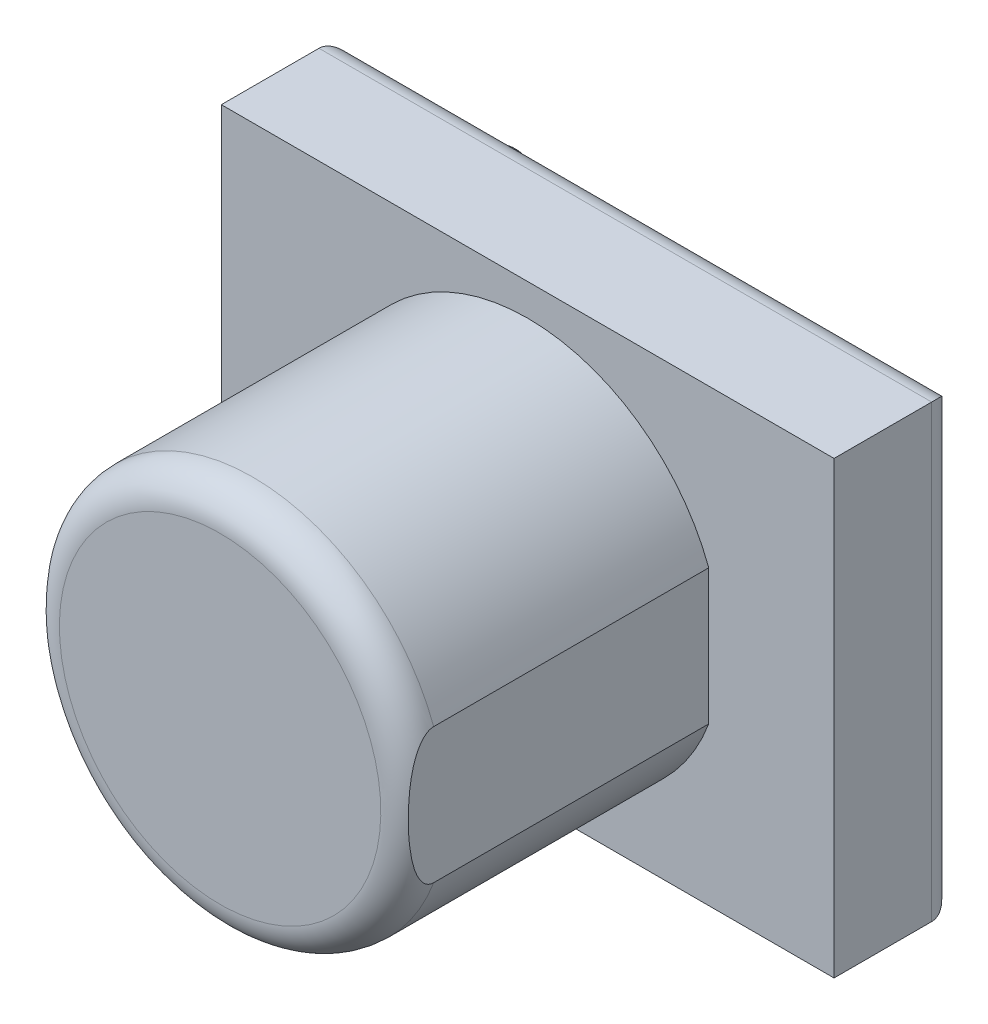
from build123d import *

# Parameters (mm, degrees)
SKETCH1_W               = 11.303
SKETCH1_H               = 4.219764922
BOSS_EXTRUDE1_DEPTH     = 9.6012
SKETCH2_W               = 19.1262
SKETCH2_H               = 14.0462
BOSS_EXTRUDE2_DEPTH     = 3.81
SKETCH3_W               = 14.8082
SKETCH3_H               = 8.763
BOSS_EXTRUDE3_DEPTH     = 2.921
CUT_EXTRUDE1_DEPTH      = 18.711601402
CUT_EXTRUDE1_DEPTH_BACK = 18.711601402
FILLET1_R               = 0.762
FILLET2_R               = 0.762
FILLET3_R               = 0.762
FILLET4_R               = 1.016


with BuildPart() as part:
    # Sketch1 → Boss-Extrude1 (new body)
    with BuildSketch(Plane.XY):
        with BuildLine():
            ThreePointArc((5.6515, 2.109882461), (0, 6.0325), (-5.6515, 2.109882461))
            Line((-5.6515, 2.109882461), (5.6515, 2.109882461))
        make_face()
        Rectangle(SKETCH1_W, SKETCH1_H)
        with BuildLine():
            Line((5.6515, -2.109882461), (-5.6515, -2.109882461))
            ThreePointArc((-5.6515, -2.109882461), (0, -6.0325), (5.6515, -2.109882461))
        make_face()
    extrude(amount=BOSS_EXTRUDE1_DEPTH)

    # Sketch2 → Boss-Extrude2 (add)
    with BuildSketch(Plane(origin=(0, 0, 0), x_dir=(-1, 0, 0), z_dir=(0, 0, -1))):
        Rectangle(SKETCH2_W, SKETCH2_H)
    extrude(amount=BOSS_EXTRUDE2_DEPTH)

    # Sketch3 → Boss-Extrude3 (add)
    with BuildSketch(Plane(origin=(0, 0, -3.81), x_dir=(-1, 0, 0), z_dir=(0, 0, -1))):
        Rectangle(SKETCH3_W, SKETCH3_H)
    extrude(amount=BOSS_EXTRUDE3_DEPTH)

    # Sketch4 → Cut-Extrude1 (cut, two sides: drawn at the far end of the back side and taken through both)
    with BuildSketch(Plane.XZ.offset(4.3815).offset(-CUT_EXTRUDE1_DEPTH_BACK)):
        with BuildLine():
            Line((7.4041, -6.731), (7.4041, -3.81))
            ThreePointArc((7.4041, -3.81), (-0.063420224, -4.948987039), (-7.4041, -6.731))
            Line((-7.4041, -6.731), (7.4041, -6.731))
        make_face()
    extrude(amount=CUT_EXTRUDE1_DEPTH + CUT_EXTRUDE1_DEPTH_BACK, mode=Mode.SUBTRACT)

    # Fillet1
    fillet1_edges = [part.edges().sort_by_distance(p)[0] for p in [
        (-7.4041, 0, -6.731),
    ]]
    fillet(fillet1_edges, radius=FILLET1_R)

    # Fillet2
    fillet2_edges = [part.edges().sort_by_distance(p)[0] for p in [
        (-9.5631, 0, -3.81),
        (0, 7.0231, -3.81),
        (9.5631, 0, -3.81),
        (0, -7.0231, -3.81),
    ]]
    fillet(fillet2_edges, radius=FILLET2_R)

    # Fillet3
    fillet3_edges = [part.edges().sort_by_distance(p)[0] for p in [
        (0.428965251, -4.3815, -4.853334027),
        (0.428965251, 4.3815, -4.853334027),
        (-7.4041, 4.3815, -4.766721364),
        (-7.103485869, 4.3815, -6.329880754),
        (-7.4041, -4.3815, -4.766721364),
        (-7.103485869, -4.3815, -6.329880754),
    ]]
    fillet(fillet3_edges, radius=FILLET3_R)

    # Fillet4
    # the kernel refuses this fillet: 1.016 mm, written as the material it takes off along each edge
    with BuildSketch(Plane(origin=(0, 0, 9.6012), x_dir=(0.9979431218880589, -0.06410558069555868, 0), z_dir=(-0.06410558069555868, -0.9979431218880589, 0))) as fillet4_piece_1:
        with BuildLine():
            CenterArc((6.0325 - FILLET4_R, -FILLET4_R), FILLET4_R, 0, 90)
            Line((6.0325 - FILLET4_R, 0), (6.0325, 0))
            Line((6.0325, 0), (6.0325, -FILLET4_R))
        make_face()
    revolve(axis=Axis((0, 0, 9.6012), (0, 0, 1)), revolution_arc=187.350999162, mode=Mode.SUBTRACT)
    with BuildSketch(Plane(origin=(0, 0, 9.6012), x_dir=(-0.9979431218880589, 0.06410558069555859, 0), z_dir=(0.06410558069555859, 0.9979431218880589, 0))) as fillet4_piece_2:
        with BuildLine():
            CenterArc((6.0325 - FILLET4_R, -FILLET4_R), FILLET4_R, 0, 90)
            Line((6.0325 - FILLET4_R, 0), (6.0325, 0))
            Line((6.0325, 0), (6.0325, -FILLET4_R))
        make_face()
    revolve(axis=Axis((0, 0, 9.6012), (0, 0, 1)), revolution_arc=187.350999162, mode=Mode.SUBTRACT)


solid = part.part
